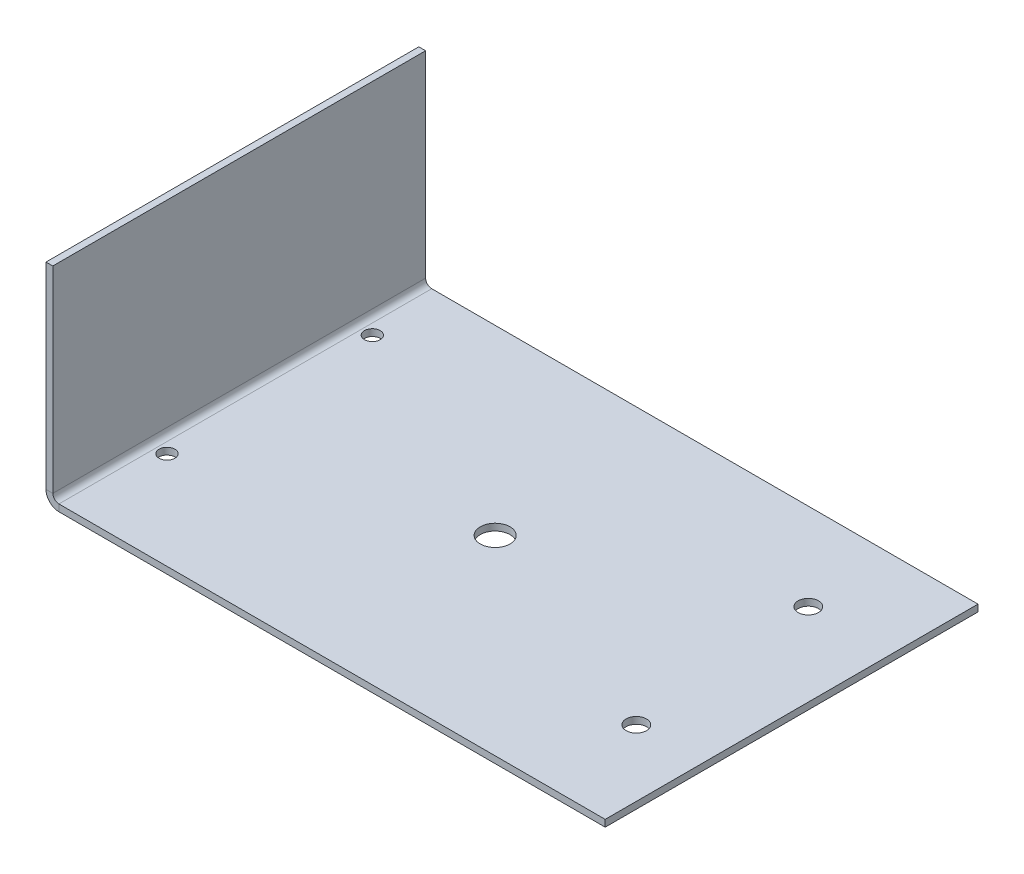
from build123d import *

# Parameters (mm, degrees)
SKETCH1_W                    = 152.4
SKETCH1_H                    = 101.6
BASE_FLANGE1_DEPTH           = 1.8542
EDGE_FLANGE1_STRIP_W         = 10.7442
EDGE_FLANGE1_STRIP_H         = 1.8542
EDGE_FLANGE1_STRIP_CUT_DEPTH = 101.6
EDGE_FLANGE1_DEPTH           = 101.6
F_1_4_20_TAPPED_HOLE1_D      = 5.55752
F_3_8_16_TAPPED_HOLE1_D      = 8.1153
F_10_32_TAPPED_HOLE1_D       = 4.3053


# Sheet-metal steps are written as plain solids
with BuildPart() as part:
    # Sketch1 → Base-Flange1 (new body)
    with BuildSketch(Plane(origin=(0, 0, 0), x_dir=(1, 0, 0), z_dir=(0, 1, 0))):
        with Locations((76.2, 50.8)):
            Rectangle(SKETCH1_W, SKETCH1_H)
    extrude(amount=-BASE_FLANGE1_DEPTH)

    # Edge-Flange1 strip (across the edge) → Edge-Flange1 strip cut (cut)
    with BuildSketch(Plane.XY.offset(-101.6)):
        with Locations((-1.8542, -0.9271)):
            Rectangle(EDGE_FLANGE1_STRIP_W, EDGE_FLANGE1_STRIP_H)
    extrude(amount=EDGE_FLANGE1_STRIP_CUT_DEPTH, mode=Mode.SUBTRACT)

    # Edge-Flange1 section (across the edge) → Edge-Flange1 (add)
    with BuildSketch(Plane.XY.offset(-101.6)):
        with BuildLine():
            Line((0, 1.6637), (0, 55.3339))
            Line((0, 55.3339), (1.8542, 55.3339))
            Line((1.8542, 55.3339), (1.8542, 1.6637))
            ThreePointArc((1.8542, 1.6637), (2.341486448, 0.487286448), (3.5179, 0))
            Line((3.5179, 0), (3.5179, -1.8542))
            ThreePointArc((3.5179, -1.8542), (1.030369054, -0.823830946), (0, 1.6637))
        make_face()
    extrude(amount=EDGE_FLANGE1_DEPTH)

    # 1/4-20 Tapped Hole1 (through all)
    with Locations(Plane(origin=(0, 0, 0), x_dir=(1, 0, 0), z_dir=(0, 1, 0))):
        with Locations((129.87815907, 77.870917938), (134.322155935, 26.560738372)):
            Hole(F_1_4_20_TAPPED_HOLE1_D / 2)

    # 3/8-16 Tapped Hole1 (through all)
    with Locations(Plane(origin=(0, 0, 0), x_dir=(1, 0, 0), z_dir=(0, 1, 0))):
        with Locations((70.38044711, 52.025325842)):
            Hole(F_3_8_16_TAPPED_HOLE1_D / 2)

    # #10-32 Tapped Hole1 (through all)
    with Locations(Plane(origin=(6.383092755, 0, -26.580603581), x_dir=(0, 0, 1), z_dir=(0, 1, 0))):
        with Locations((0, 0), (-55.970741812, 0.005307766)):
            Hole(F_10_32_TAPPED_HOLE1_D / 2)


solid = part.part
